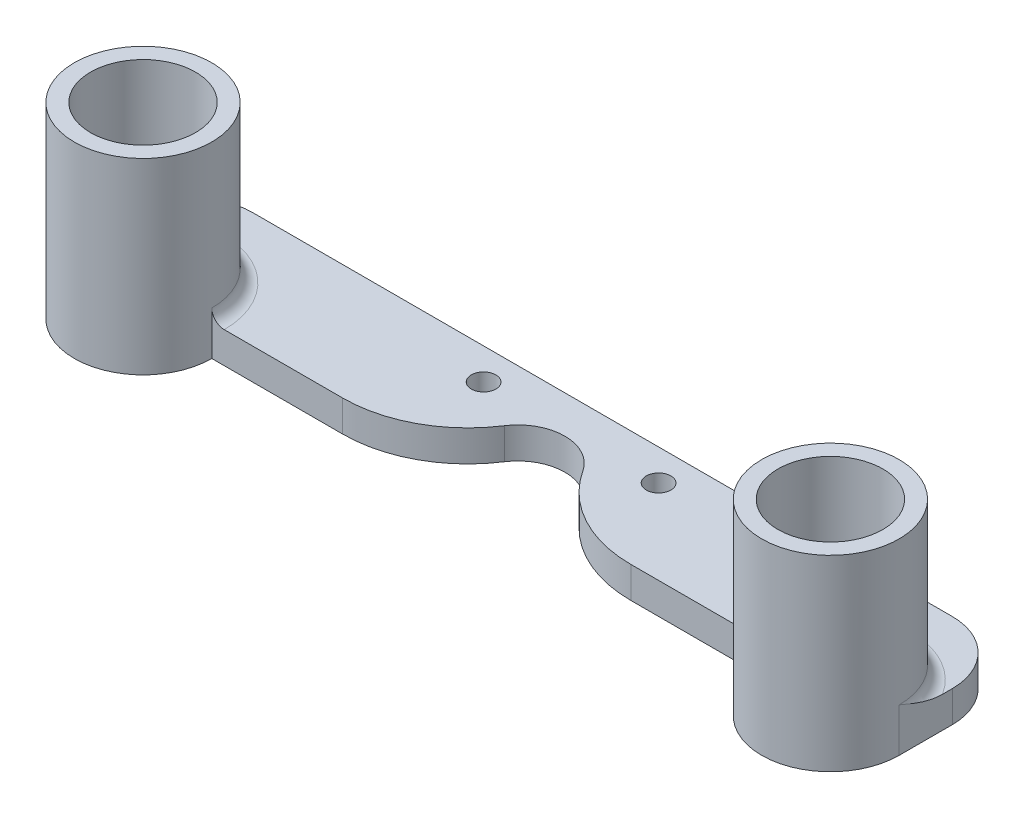
from build123d import *

# Parameters (mm, degrees)
SKETCH1_R           = 10.668
SKETCH1_R_2         = 2.5
BOSS_EXTRUDE1_DEPTH = 6.35
SKETCH2_R           = 13.97
SKETCH2_R_2         = 10.668
BOSS_EXTRUDE2_DEPTH = 31.75
FILLET1_R           = 2.54


with BuildPart() as part:
    # Sketch1 → Boss-Extrude1 (new body)
    with BuildSketch(Plane(origin=(0, 0, 0), x_dir=(1, 0, 0), z_dir=(0, 1, 0))):
        with BuildLine():
            Line((-81.070713968, 0), (-54.46276762, 0))
            ThreePointArc((-54.46276762, 0), (-42.353792737, 3.072153546), (-33.174001328, 11.545454545))
            ThreePointArc((-33.174001328, 11.545454545), (-25.190713968, 15.875), (-17.207426609, 11.545454545))
            ThreePointArc((-17.207426609, 11.545454545), (-8.0276352, 3.072153546), (4.081339684, 0))
            Line((4.081339684, 0), (30.689286032, 0))
            ThreePointArc((30.689286032, 0), (44.659286032, -13.97), (58.629286032, 0))
            Line((58.629286032, 0), (58.629286032, 10.795))
            ThreePointArc((58.629286032, 10.795), (54.909542153, 19.775256121), (45.929286032, 23.495))
            Line((45.929286032, 23.495), (-96.310713968, 23.495))
            ThreePointArc((-96.310713968, 23.495), (-105.290970089, 19.775256121), (-109.010713968, 10.795))
            Line((-109.010713968, 10.795), (-109.010713968, 0))
            ThreePointArc((-109.010713968, 0), (-95.040713968, -13.97), (-81.070713968, 0))
        make_face()
        with Locations(Location((-95.040713968, 0, 0), (0, 0, 270))):
            Circle(SKETCH1_R, mode=Mode.SUBTRACT)
        with Locations(Location((44.659286032, 0, 0), (0, 0, 270))):
            Circle(SKETCH1_R, mode=Mode.SUBTRACT)
        with Locations(Location((-7.410713968, 17.145, 0), (0, 0, 270))):
            Circle(SKETCH1_R_2, mode=Mode.SUBTRACT)
        with Locations(Location((-42.970713968, 17.145, 0), (0, 0, 270))):
            Circle(SKETCH1_R_2, mode=Mode.SUBTRACT)
    extrude(amount=BOSS_EXTRUDE1_DEPTH)

    # Sketch2 → Boss-Extrude2 (add)
    # profile 1 of 2: a face of its own
    with BuildSketch(Plane(origin=(0, 6.35, 0), x_dir=(1, 0, 0), z_dir=(0, 1, 0))):
        with Locations((-95.040713968, 0)):
            Circle(SKETCH2_R)
        with Locations(Location((-95.040713968, 0, 0), (0, 0, 270))):
            Circle(SKETCH2_R_2, mode=Mode.SUBTRACT)
    # profile 2 of 2: a face of its own
    with BuildSketch(Plane(origin=(0, 6.35, 0), x_dir=(1, 0, 0), z_dir=(0, 1, 0))):
        with Locations((44.659286032, 0)):
            Circle(SKETCH2_R)
        with Locations(Location((44.659286032, 0, 0), (0, 0, 270))):
            Circle(SKETCH2_R_2, mode=Mode.SUBTRACT)
    extrude(amount=BOSS_EXTRUDE2_DEPTH)

    # Fillet1
    # the kernel refuses this fillet: 2.54 mm, written as the material it adds along each edge
    with BuildSketch(Plane(origin=(-95.040713968, 6.35, 0), x_dir=(1, 0, 0), z_dir=(0, 0, 1))) as fillet1_piece_1_section:
        with BuildLine():
            CenterArc((13.97 + FILLET1_R, FILLET1_R), FILLET1_R, 180, 90)
            Line((13.97, FILLET1_R), (13.97, 0))
            Line((13.97, 0), (13.97 + FILLET1_R, 0))
        make_face()
    fillet1_piece_1 = revolve(axis=Axis((-95.040713968, 6.35, 0), (0, 1, 0)), revolution_arc=180, mode=Mode.PRIVATE)
    fillet1_piece_1 = split(fillet1_piece_1, bisect_by=Plane(origin=(-109.010713968, 7.066562121, -14.686562121), z_dir=(1, 0, 0)), keep=Keep.TOP, mode=Mode.PRIVATE)
    add(fillet1_piece_1)
    with BuildSketch(Plane(origin=(44.659286032, 6.35, 0), x_dir=(1, 0, 0), z_dir=(0, 0, 1))) as fillet1_piece_2_section:
        with BuildLine():
            CenterArc((13.97 + FILLET1_R, FILLET1_R), FILLET1_R, 180, 90)
            Line((13.97, FILLET1_R), (13.97, 0))
            Line((13.97, 0), (13.97 + FILLET1_R, 0))
        make_face()
    fillet1_piece_2 = revolve(axis=Axis((44.659286032, 6.35, 0), (0, 1, 0)), revolution_arc=180, mode=Mode.PRIVATE)
    fillet1_piece_2 = split(fillet1_piece_2, bisect_by=Plane(origin=(58.629286032, 7.62, -14.008730581), z_dir=(-1, 0, 0)), keep=Keep.TOP, mode=Mode.PRIVATE)
    add(fillet1_piece_2)


solid = part.part
